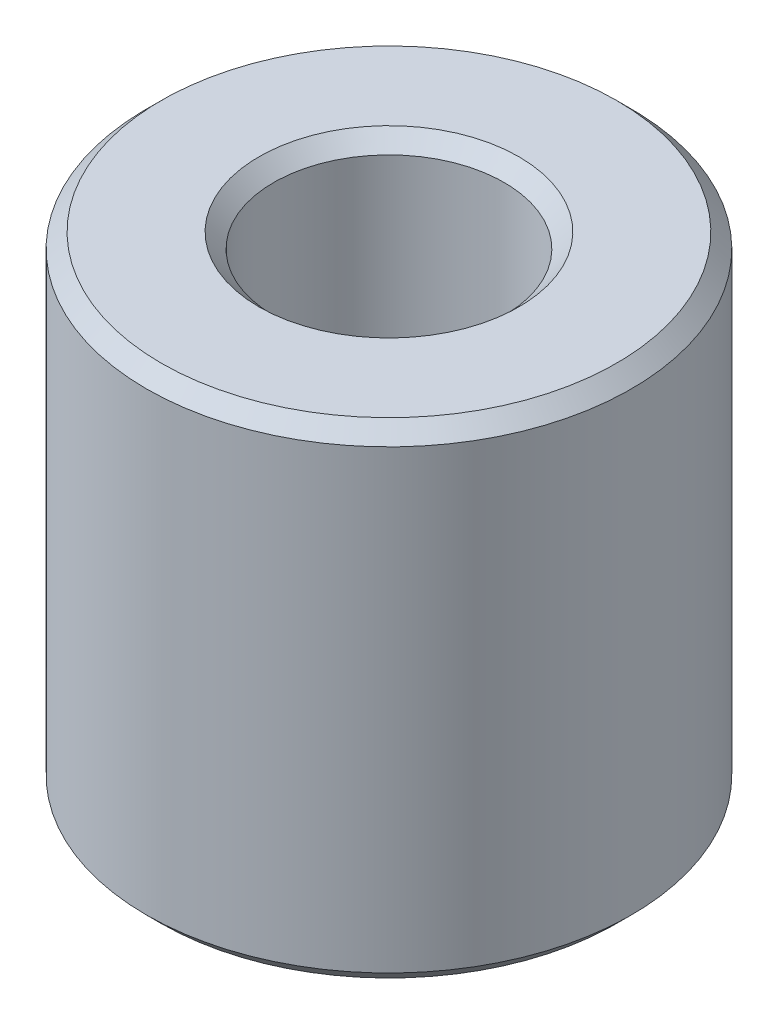
from build123d import *

# Parameters (mm, degrees)
SKETCH1_R           = 50
BOSS_EXTRUDE1_DEPTH = 100.081244842
SKETCH2_R           = 23.760819673
CUT_EXTRUDE1_DEPTH  = 123.540832252
CHAMFER1_SIZE       = 3.056615017


with BuildPart() as part:
    # Sketch1 → Boss-Extrude1 (new body)
    with BuildSketch(Plane(origin=(0, 0, 0), x_dir=(1, 0, 0), z_dir=(0, 1, 0))):
        Circle(SKETCH1_R)
    extrude(amount=BOSS_EXTRUDE1_DEPTH)

    # Sketch2 → Cut-Extrude1 (cut, through all)
    with BuildSketch(Plane(origin=(0, 0, 0), x_dir=(1, 0, 0), z_dir=(0, 1, 0))):
        Circle(SKETCH2_R)
    extrude(amount=CUT_EXTRUDE1_DEPTH, mode=Mode.SUBTRACT)

    # Chamfer1
    chamfer1_edges = [part.edges().sort_by_distance(p)[0] for p in [
        (-23.760819673, 100.081244842, 0),
        (-23.760819673, 0, 0),
        (-50, 0, 0),
        (-50, 100.081244842, 0),
    ]]
    chamfer(chamfer1_edges, length=CHAMFER1_SIZE)


solid = part.part
